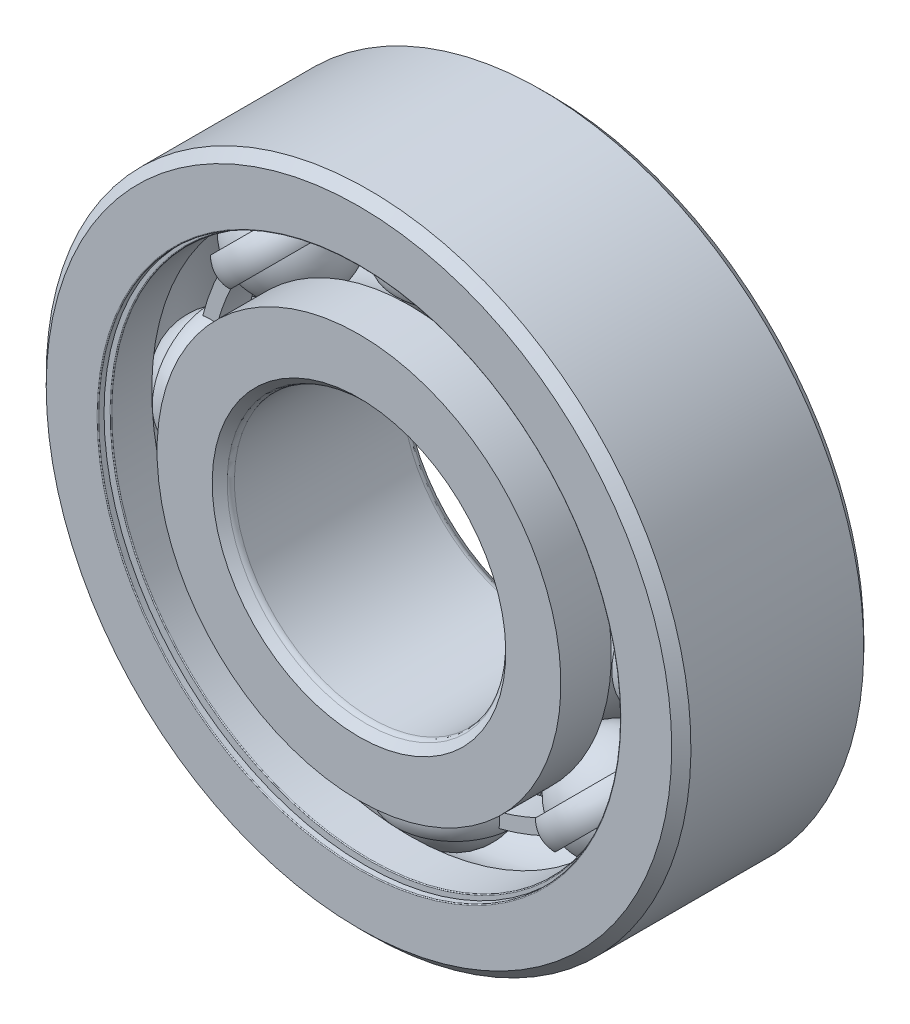
from build123d import *

# Parameters (mm, degrees)
BOSS_EXTRUDE1_DEPTH = 1.166666667
CIRPATTERN1_COUNT   = 8
CIRPATTERN2_COUNT   = 8
FILLET1_R           = 0.063
FILLET2_R           = 0.525


with BuildPart() as part:
    # Sketch3 → Revolve1 (revolve)
    with BuildSketch(Plane(origin=(0, 0, 0), x_dir=(0, 0, -1), z_dir=(1, 0, 0))):
        with BuildLine():
            Line((6.3, 23.5), (7, 22.8))
            Line((7, 22.8), (7, 18.780769231))
            Line((7, 18.780769231), (3.325, 18.780769231))
            ThreePointArc((3.325, 18.780769231), (0, 20.646106861), (-3.325, 18.780769231))
            Line((-3.325, 18.780769231), (-7, 18.780769231))
            Line((-7, 18.780769231), (-7, 22.8))
            Line((-7, 22.8), (-6.3, 23.5))
            Line((-6.3, 23.5), (6.3, 23.5))
        make_face()
    revolve(axis=Axis((0, 0, 7), (0, 0, -1)))

    # Sketch8 → Cut-Revolve1 (revolve, cut)
    with BuildSketch(Plane(origin=(0, 0, 0), x_dir=(0, 0, -1), z_dir=(1, 0, 0))):
        Polygon((-6.552, 18.780769231), (-6.3, 18.780769231), (-6.3, 20.353846154), (-6.552, 20.353846154), (-6.552, 19.032769231), (-7, 19.032769231), (-7, 18.780769231), align=None)
        Polygon((6.3, 18.780769231), (6.552, 18.780769231), (7, 18.780769231), (7, 19.032769231), (6.552, 19.032769231), (6.552, 20.353846154), (6.3, 20.353846154), align=None)
    revolve(axis=Axis((0, 0, 7), (0, 0, -1)), mode=Mode.SUBTRACT)

    # Fillet1
    fillet1_edges = [part.edges().sort_by_distance(p)[0] for p in [
        (0, -18.780769231, -6.3),
        (0, -19.032769231, -7),
        (0, -18.780769231, 6.3),
        (0, -19.032769231, 7),
    ]]
    fillet(fillet1_edges, radius=FILLET1_R)


with BuildPart() as body_2:
    # Sketch4 → Revolve2 (revolve)
    with BuildSketch(Plane(origin=(0, 0, 0), x_dir=(0, 0, -1), z_dir=(1, 0, 0))):
        with BuildLine():
            Line((-6.3, 10), (-7, 10.7))
            Line((-7, 10.7), (-7, 14.719230769))
            Line((-7, 14.719230769), (-3.325, 14.719230769))
            ThreePointArc((-3.325, 14.719230769), (0, 12.853893139), (3.325, 14.719230769))
            Line((3.325, 14.719230769), (7, 14.719230769))
            Line((7, 14.719230769), (7, 10.7))
            Line((7, 10.7), (6.3, 10))
            Line((6.3, 10), (-6.3, 10))
        make_face()
    revolve(axis=Axis((0, 0, 7), (0, 0, -1)))

    # Fillet2
    fillet2_edges = [body_2.edges().sort_by_distance(p)[0] for p in [
        (0, -10, -6.3),
        (0, -10, 6.3),
    ]]
    fillet(fillet2_edges, radius=FILLET2_R)


with BuildPart() as body_3:
    # Sketch5 → Revolve3 (revolve)
    with BuildSketch(Plane(origin=(0, 0, 0), x_dir=(0, 0, -1), z_dir=(1, 0, 0))):
        with BuildLine():
            Line((-3.896106861, 16.75), (3.896106861, 16.75))
            ThreePointArc((3.896106861, 16.75), (0, 20.646106861), (-3.896106861, 16.75))
        make_face()
    revolve(axis=Axis((0, 16.75, 3.896106861), (0, 0, -1)))


with BuildPart() as body_4:
    # Sketch6 → Revolve4 (revolve)
    with BuildSketch(Plane(origin=(0, 0, 0), x_dir=(0, 0, -1), z_dir=(1, 0, 0))):
        with BuildLine():
            Line((-3.761468164, 17.765384615), (-4.30122347, 17.765384615))
            ThreePointArc((-4.30122347, 17.765384615), (-4.571101123, 16.75), (-4.30122347, 15.734615385))
            Line((-4.30122347, 15.734615385), (-3.761468164, 15.734615385))
            ThreePointArc((-3.761468164, 15.734615385), (-3.896106861, 16.75), (-3.761468164, 17.765384615))
        make_face()
    revolve4 = revolve(axis=Axis((0, 23.5, 0), (0, -1, 0)))

    # Sketch7 → Boss-Extrude1 (add, symmetric)
    with BuildSketch(Plane.XY):
        with BuildLine():
            Line((12.348575073, 11.317031133), (13.09714541, 12.003069301))
            ThreePointArc((13.09714541, 12.003069301), (7.154360483, 16.261119783), (0, 17.765384615))
            Line((0, 17.765384615), (0, 16.75))
            ThreePointArc((0, 16.75), (6.745451375, 15.331711768), (12.348575073, 11.317031133))
        make_face()
    boss_extrude1 = extrude(amount=BOSS_EXTRUDE1_DEPTH, both=True)

    # CirPattern2: Revolve4, Boss-Extrude1 ×8 about axis
    cirpattern2_axis = Axis((0, 0, 7), (0, 0, -1))
    add([revolve4.rotate(cirpattern2_axis, i * 360 / CIRPATTERN2_COUNT) for i in range(1, CIRPATTERN2_COUNT)])
    add([boss_extrude1.rotate(cirpattern2_axis, i * 360 / CIRPATTERN2_COUNT) for i in range(1, CIRPATTERN2_COUNT)])


with BuildPart() as cirpattern1_1:
    # CirPattern1: pattern copy
    add(body_3.part.rotate(Axis((0, 0, 7), (0, 0, -1)), 1 * 360 / CIRPATTERN1_COUNT))


with BuildPart() as cirpattern1_2:
    # CirPattern1: pattern copy
    add(body_3.part.rotate(Axis((0, 0, 7), (0, 0, -1)), 2 * 360 / CIRPATTERN1_COUNT))


with BuildPart() as cirpattern1_3:
    # CirPattern1: pattern copy
    add(body_3.part.rotate(Axis((0, 0, 7), (0, 0, -1)), 3 * 360 / CIRPATTERN1_COUNT))


with BuildPart() as cirpattern1_4:
    # CirPattern1: pattern copy
    add(body_3.part.rotate(Axis((0, 0, 7), (0, 0, -1)), 4 * 360 / CIRPATTERN1_COUNT))


with BuildPart() as cirpattern1_5:
    # CirPattern1: pattern copy
    add(body_3.part.rotate(Axis((0, 0, 7), (0, 0, -1)), 5 * 360 / CIRPATTERN1_COUNT))


with BuildPart() as cirpattern1_6:
    # CirPattern1: pattern copy
    add(body_3.part.rotate(Axis((0, 0, 7), (0, 0, -1)), 6 * 360 / CIRPATTERN1_COUNT))


with BuildPart() as cirpattern1_7:
    # CirPattern1: pattern copy
    add(body_3.part.rotate(Axis((0, 0, 7), (0, 0, -1)), 7 * 360 / CIRPATTERN1_COUNT))


solid = Compound([part.part, body_2.part, body_3.part, body_4.part, cirpattern1_1.part, cirpattern1_2.part, cirpattern1_3.part, cirpattern1_4.part, cirpattern1_5.part, cirpattern1_6.part, cirpattern1_7.part])
